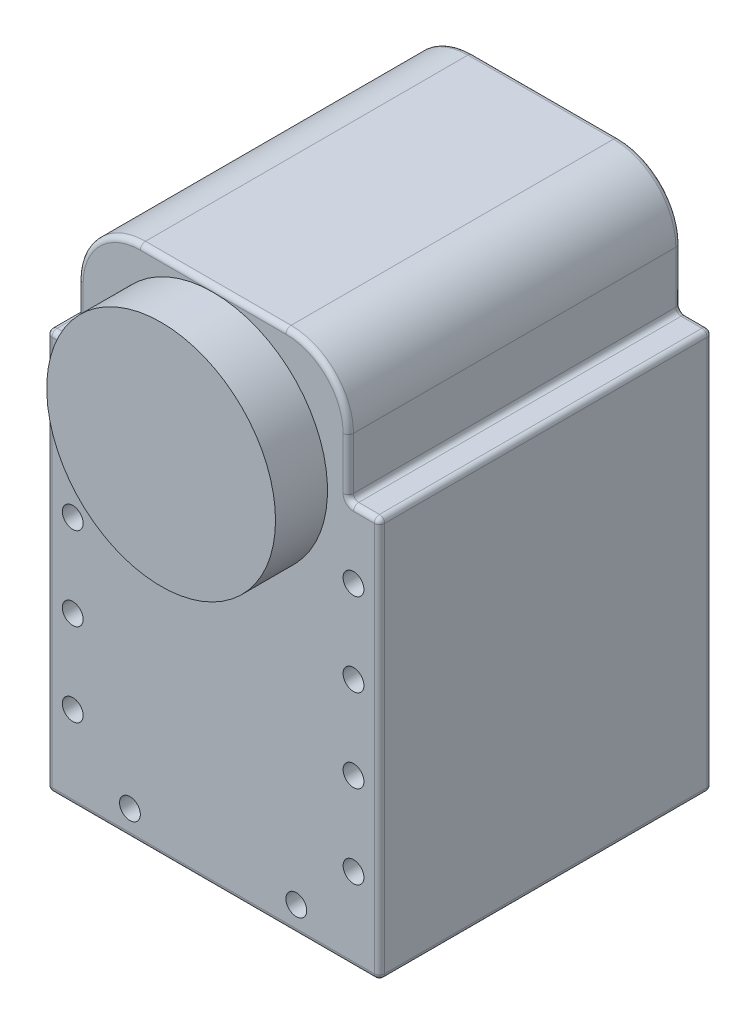
from build123d import *

# Parameters (mm, degrees)
IZIM1_W                          = 32
IZIM1_H                          = 50
Y_KSEKLIK_EKSTR_ZYON1_DEPTH      = 32
IZIM2_R                          = 1
IZIM2_W                          = 3
IZIM2_H                          = 11.5
KES_EKSTR_ZYON1_DEPTH            = 32
RADYUS2_R                        = 6
IZIM3_R                          = 11
Y_KSEKLIK_EKSTR_ZYON2_DEPTH      = 5
IZIM4_R                          = 5.5
Y_KSEKLIK_EKSTR_ZYON3_DEPTH      = 3
RADYUS3_R                        = 0.5
Y_KSEKLIK_EKSTR_ZYON4_DEPTH      = 13
Y_KSEKLIK_EKSTR_ZYON4_DEPTH_BACK = 13
IZIM5_W                          = 31
IZIM5_H                          = 37.5


with BuildPart() as part:
    # Çizim1 → Yükseklik-Ekstrüzyon1 (new body)
    with BuildSketch(Plane.XY):
        Rectangle(IZIM1_W, IZIM1_H)
    extrude(amount=Y_KSEKLIK_EKSTR_ZYON1_DEPTH)

    # Çizim2 → Kes-Ekstrüzyon1 (cut)
    with BuildSketch(Plane.XY.offset(32)):
        with Locations((-8, -22.5)):
            Circle(IZIM2_R)
        with Locations((-13.5, -17)):
            Circle(IZIM2_R)
        with Locations((-13.5, -9)):
            Circle(IZIM2_R)
        with Locations((-13.5, -1)):
            Circle(IZIM2_R)
        with Locations((-13.5, 7)):
            Circle(IZIM2_R)
        with Locations((-14.5, 19.25)):
            Rectangle(IZIM2_W, IZIM2_H)
    kes_ekstr_zyon1 = extrude(amount=-KES_EKSTR_ZYON1_DEPTH, mode=Mode.SUBTRACT)

    # Aynalama1: Kes-Ekstrüzyon1 across plane
    add(kes_ekstr_zyon1.mirror(Plane(origin=(0, 0, 0), x_dir=(0, 0, 1), z_dir=(1, 0, 0))), mode=Mode.SUBTRACT)

    # Radyus2
    radyus2_edges = [part.edges().sort_by_distance(p)[0] for p in [
        (-13, 25, 16),
        (13, 25, 16),
    ]]
    fillet(radyus2_edges, radius=RADYUS2_R)

    # Çizim3 → Yükseklik-Ekstrüzyon2 (add)
    with BuildSketch(Plane.XY.offset(32)):
        with Locations((0, 13.5)):
            Circle(IZIM3_R)
    extrude(amount=Y_KSEKLIK_EKSTR_ZYON2_DEPTH)

    # Çizim4 → Yükseklik-Ekstrüzyon3 (add)
    with BuildSketch(Plane(origin=(0, 0, 0), x_dir=(-1, 0, 0), z_dir=(0, 0, -1))):
        with Locations(Location((0, 13.5, 0), (0, 0, 180))):
            Circle(IZIM4_R)
    extrude(amount=Y_KSEKLIK_EKSTR_ZYON3_DEPTH)

    # Radyus3
    radyus3_edges = [part.edges().sort_by_distance(p)[0] for p in [
        (-5.5, 13.5, 0),
        (0, -25, 32),
        (-16, -5.75, 0),
        (-16, -5.75, 32),
        (-13, 16.25, 0),
        (-14.5, 13.5, 0),
        (-13, 13.5, 16),
        (-16, 13.5, 16),
        (-14.5, 13.5, 32),
        (-13, 16.25, 32),
        (16, -5.75, 32),
        (0, -25, 0),
        (16, -5.75, 0),
        (14.5, 13.5, 32),
        (16, 13.5, 16),
        (13, 16.25, 32),
        (13, 13.5, 16),
        (14.5, 13.5, 0),
        (13, 16.25, 0),
        (16, -25, 16),
        (-16, -25, 16),
        (0, 25, 32),
        (-11.242640687, 23.242640687, 32),
        (11.242640687, 23.242640687, 32),
        (0, 25, 0),
        (-11.242640687, 23.242640687, 0),
        (11.242640687, 23.242640687, 0),
    ]]
    fillet(radyus3_edges, radius=RADYUS3_R - 0.0001)  # a hair under: the kernel refuses the full size

    # Çizim5 → Yükseklik-Ekstrüzyon4 (add, two sides: drawn at the far end of the back side and taken through both)
    with BuildSketch(Plane.XY.offset(16).offset(-Y_KSEKLIK_EKSTR_ZYON4_DEPTH_BACK)):
        with Locations((0, -5.75)):
            Rectangle(IZIM5_W, IZIM5_H)
    extrude(amount=Y_KSEKLIK_EKSTR_ZYON4_DEPTH + Y_KSEKLIK_EKSTR_ZYON4_DEPTH_BACK)


solid = part.part
